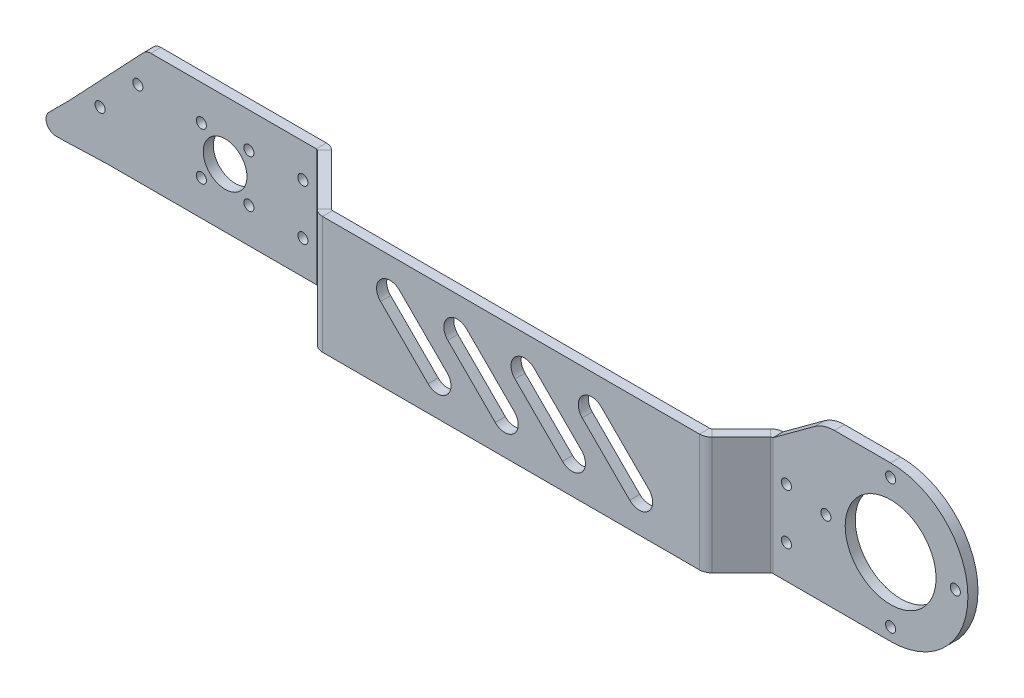
from build123d import *

# Parameters (mm, degrees)
SKETCH_1_R               = 6.5
SKETCH_1_R_2             = 1.5
SM_BASE_FLANGE_1_DEPTH   = 3
OTHER_START              = -17.5
OTHER_1_DEPTH            = 35
OTHER_1_2_DEPTH          = 35
SKETCH_7_W               = 142
SKETCH_7_H               = 35
EXTRUDE_1_DEPTH          = 3
OTHER_2_DEPTH            = 35
OTHER_START_2            = 8.571067912
OTHER_2_2_DEPTH          = 8.928932088
OTHER_2_3_DEPTH          = 26.071067912
OTHER_START_3            = 7
OTHER_2_4_OUTLINE_R      = 6.5
OTHER_2_4_OUTLINE_R_2    = 1.5
OTHER_2_4_DEPTH          = 3
OTHER_START_4            = 13.5
OTHER_2_5_OUTLINE_W      = 3.949658474
OTHER_2_5_OUTLINE_H      = 35
OTHER_2_5_DEPTH          = 3
SKETCH_9_W               = 40.525450659
SKETCH_9_H               = 35
CUT_EXTRUDE_1_DEPTH      = 216.548037247
EXTRUDE_START            = -6.5
SKETCH_10_R              = 13.515
SKETCH_10_R_2            = 1.5
EXTRUDE_2_DEPTH          = 3
FILLET_2_R               = 10
EXTRUDE_START_2          = -3
EXTRUDE_3_DEPTH          = 3
CUT_EXTRUDE_2_DEPTH      = 3
FILLET_3_R               = 3
SKETCH_13_R              = 1.5
CUT_EXTRUDE_3_DEPTH      = 3
CUT_EXTRUDE_4_DEPTH      = 10
CUT_EXTRUDE_4_DEPTH_BACK = 10
SKETCH_14_R              = 1.5
CUT_EXTRUDE_5_DEPTH      = 234.75556456


with BuildPart() as part:
    # 基体-法兰1: sheet metal written as solids
    # Sketch 1 → 基体-法兰1 (new body)
    with BuildSketch(Plane.XY):
        with BuildLine():
            Line((-55, -2.5), (-55, 17.5))
            Line((-55, 17.5), (-25, 17.5))
            Line((-25, 17.5), (25, 17.5))
            Line((25, 17.5), (68, 17.5))
            Line((68, 17.5), (68, -17.5))
            Line((68, -17.5), (25, -17.5))
            Line((25, -17.5), (-25, -17.5))
            Line((-25, -17.5), (-35, -17.5))
            ThreePointArc((-35, -17.5), (-44.006294251, -8.675059002), (-55, -2.5))
        make_face()
        Circle(SKETCH_1_R, mode=Mode.SUBTRACT)
        with Locations((7.071067812, 7.071067812)):
            Circle(SKETCH_1_R_2, mode=Mode.SUBTRACT)
        with Locations((7.071067812, -7.071067812)):
            Circle(SKETCH_1_R_2, mode=Mode.SUBTRACT)
        with Locations((-7.071067812, -7.071067812)):
            Circle(SKETCH_1_R_2, mode=Mode.SUBTRACT)
        with Locations((-7.071067812, 7.071067812)):
            Circle(SKETCH_1_R_2, mode=Mode.SUBTRACT)
    extrude(amount=-SM_BASE_FLANGE_1_DEPTH)

    # Other 1: read off the stored shape, not the designer's step
    # Other 1 outline → Other 1 (cut)
    with BuildSketch(Plane(origin=(0, 0, 0), x_dir=(1, 0, 0), z_dir=(0, 1, 0)).offset(OTHER_START)):
        with BuildLine():
            Line((29.763864432, 1.905575199), (31.669439631, 0))
            Line((31.669439631, 0), (68, 0))
            Line((68, 0), (68, 3))
            Line((68, 3), (27.121689234, 3))
            ThreePointArc((27.121689234, 3), (28.551624147, 2.715568261), (29.763864432, 1.905575199))
        make_face()
    extrude(amount=OTHER_1_DEPTH, mode=Mode.SUBTRACT)

    # Other 1 2 outline → Other 1 2 (add)
    with BuildSketch(Plane(origin=(0, 0, 0), x_dir=(1, 0, 0), z_dir=(0, 1, 0)).offset(OTHER_START)):
        with BuildLine():
            ThreePointArc((45.474549341, -13.5), (45.192664725, -13.443929664), (44.953694486, -13.284254855))
            Line((44.953694486, -13.284254855), (31.669439631, 0))
            Line((31.669439631, 0), (27.121689234, 0))
            ThreePointArc((27.121689234, 0), (27.40357385, -0.056070336), (27.642544089, -0.215745145))
            Line((27.642544089, -0.215745145), (42.832374142, -15.405575199))
            ThreePointArc((42.832374142, -15.405575199), (44.044614428, -16.215568261), (45.474549341, -16.5))
            Line((45.474549341, -16.5), (68, -16.5))
            Line((68, -16.5), (68, -13.5))
            Line((68, -13.5), (45.474549341, -13.5))
        make_face()
    extrude(amount=OTHER_1_2_DEPTH)

    # 草图7 → 凸台-拉伸1 (add)
    with BuildSketch(Plane.XY.offset(16.5)):
        with Locations((139, 0)):
            Rectangle(SKETCH_7_W, SKETCH_7_H)
    extrude(amount=-EXTRUDE_1_DEPTH)

    # Other 2: read off the stored shape, not the designer's step
    # Other 2 outline → Other 2 (cut)
    with BuildSketch(Plane(origin=(0, 0, 0), x_dir=(1, 0, 0), z_dir=(0, 1, 0)).offset(OTHER_START)):
        with BuildLine():
            Line((45.474549341, -16.5), (168.876457417, -16.5))
            Line((168.876457417, -16.5), (170.782032616, -14.594424801))
            ThreePointArc((170.782032616, -14.594424801), (171.994272902, -13.784431739), (173.424207815, -13.5))
            Line((173.424207815, -13.5), (45.474549341, -13.5))
            ThreePointArc((45.474549341, -13.5), (45.192664725, -13.443929664), (44.953694486, -13.284254855))
            Line((44.953694486, -13.284254855), (29.763864432, 1.905575199))
            ThreePointArc((29.763864432, 1.905575199), (28.551624147, 2.715568261), (27.121689234, 3))
            Line((27.121689234, 3), (-55, 3))
            Line((-55, 3), (-55, 0))
            Line((-55, 0), (27.121689234, 0))
            ThreePointArc((27.121689234, 0), (27.40357385, -0.056070336), (27.642544089, -0.215745145))
            Line((27.642544089, -0.215745145), (42.832374142, -15.405575199))
            ThreePointArc((42.832374142, -15.405575199), (44.044614428, -16.215568261), (45.474549341, -16.5))
        make_face()
    extrude(amount=OTHER_2_DEPTH, mode=Mode.SUBTRACT)

    # Other 2 2 outline → Other 2 2 (add)
    with BuildSketch(Plane(origin=(0, 0, 0), x_dir=(1, 0, 0), z_dir=(0, 1, 0)).offset(OTHER_START_2)):
        with BuildLine():
            Line((49.424207815, -26.5), (161.571347708, -26.5))
            ThreePointArc((161.571347708, -26.5), (163.001282621, -26.215568261), (164.213522906, -25.405575199))
            Line((164.213522906, -25.405575199), (172.90335296, -16.715745145))
            ThreePointArc((172.90335296, -16.715745145), (173.142323199, -16.556070336), (173.424207815, -16.5))
            Line((173.424207815, -16.5), (168.876457417, -16.5))
            Line((168.876457417, -16.5), (162.092202563, -23.284254855))
            ThreePointArc((162.092202563, -23.284254855), (161.853232324, -23.443929664), (161.571347708, -23.5))
            Line((161.571347708, -23.5), (49.424207815, -23.5))
            ThreePointArc((49.424207815, -23.5), (49.142323199, -23.443929664), (48.90335296, -23.284254855))
            Line((48.90335296, -23.284254855), (33.713522906, -8.094424801))
            ThreePointArc((33.713522906, -8.094424801), (32.501282621, -7.284431739), (31.071347708, -7))
            Line((31.071347708, -7), (-51.050341526, -7))
            Line((-51.050341526, -7), (-51.050341526, -10))
            Line((-51.050341526, -10), (31.071347708, -10))
            ThreePointArc((31.071347708, -10), (31.353232324, -10.056070336), (31.592202563, -10.215745145))
            Line((31.592202563, -10.215745145), (46.782032616, -25.405575199))
            ThreePointArc((46.782032616, -25.405575199), (47.994272902, -26.215568261), (49.424207815, -26.5))
        make_face()
    extrude(amount=OTHER_2_2_DEPTH)

    # Other 2 3 outline → Other 2 3 (add)
    with BuildSketch(Plane(origin=(0, 0, 0), x_dir=(1, 0, 0), z_dir=(0, 1, 0)).offset(OTHER_START)):
        with BuildLine():
            Line((49.424207815, -26.5), (161.571347708, -26.5))
            ThreePointArc((161.571347708, -26.5), (163.001282621, -26.215568261), (164.213522906, -25.405575199))
            Line((164.213522906, -25.405575199), (172.90335296, -16.715745145))
            ThreePointArc((172.90335296, -16.715745145), (173.142323199, -16.556070336), (173.424207815, -16.5))
            Line((173.424207815, -16.5), (168.876457417, -16.5))
            Line((168.876457417, -16.5), (162.092202563, -23.284254855))
            ThreePointArc((162.092202563, -23.284254855), (161.853232324, -23.443929664), (161.571347708, -23.5))
            Line((161.571347708, -23.5), (49.424207815, -23.5))
            ThreePointArc((49.424207815, -23.5), (49.142323199, -23.443929664), (48.90335296, -23.284254855))
            Line((48.90335296, -23.284254855), (33.713522906, -8.094424801))
            ThreePointArc((33.713522906, -8.094424801), (32.501282621, -7.284431739), (31.071347708, -7))
            Line((31.071347708, -7), (-51.050341526, -7))
            Line((-51.050341526, -7), (-51.050341526, -10))
            Line((-51.050341526, -10), (31.071347708, -10))
            ThreePointArc((31.071347708, -10), (31.353232324, -10.056070336), (31.592202563, -10.215745145))
            Line((31.592202563, -10.215745145), (46.782032616, -25.405575199))
            ThreePointArc((46.782032616, -25.405575199), (47.994272902, -26.215568261), (49.424207815, -26.5))
        make_face()
    extrude(amount=OTHER_2_3_DEPTH)

    # Other 2 4 outline → Other 2 4 (cut)
    with BuildSketch(Plane.XY.offset(OTHER_START_3)):
        with BuildLine():
            Line((-51.050341526, -17.5), (-31.050341526, -17.5))
            ThreePointArc((-31.050341526, -17.5), (-40.056635778, -8.675059002), (-51.050341526, -2.5))
            Line((-51.050341526, -2.5), (-51.050341526, -17.5))
        make_face()
        with Locations((3.949658474, 0)):
            Circle(OTHER_2_4_OUTLINE_R)
        with Locations((11.020726286, 7.071067812)):
            Circle(OTHER_2_4_OUTLINE_R_2)
        with Locations((11.020726286, -7.071067812)):
            Circle(OTHER_2_4_OUTLINE_R_2)
        with Locations((-3.121409338, -7.071067812)):
            Circle(OTHER_2_4_OUTLINE_R_2)
        with Locations((-3.121409338, 7.071067812)):
            Circle(OTHER_2_4_OUTLINE_R_2)
    extrude(amount=OTHER_2_4_DEPTH, mode=Mode.SUBTRACT)

    # Other 2 5 outline → Other 2 5 (add)
    with BuildSketch(Plane.XY.offset(OTHER_START_4)):
        with Locations((211.974829237, 0)):
            Rectangle(OTHER_2_5_OUTLINE_W, OTHER_2_5_OUTLINE_H)
    extrude(amount=OTHER_2_5_DEPTH)

    # 草图9 → 切除-拉伸1 (cut, through all)
    with BuildSketch(Plane(origin=(0, 0, 7), x_dir=(-1, 0, 0), z_dir=(0, 0, -1))):
        with Locations((-193.686933145, 0)):
            Rectangle(SKETCH_9_W, SKETCH_9_H)
    extrude(amount=-CUT_EXTRUDE_1_DEPTH, mode=Mode.SUBTRACT)

    # 草图10 → 凸台-拉伸2 (add)
    with BuildSketch(Plane(origin=(0, 0, 7), x_dir=(-1, 0, 0), z_dir=(0, 0, -1)).offset(EXTRUDE_START)):
        with BuildLine():
            Line((-188.424207815, 28.5), (-208.424207815, 28.5))
            ThreePointArc((-208.424207815, 28.5), (-231.424207815, 5.5), (-208.424207815, -17.5))
            Line((-208.424207815, -17.5), (-173.424207815, -17.5))
            Line((-173.424207815, -17.5), (-173.424207815, 17.5))
            Line((-173.424207815, 17.5), (-188.424207815, 28.5))
        make_face()
        with Locations((-208.424207815, 5.5)):
            Circle(SKETCH_10_R, mode=Mode.SUBTRACT)
        with Locations((-208.424207815, 24.75)):
            Circle(SKETCH_10_R_2, mode=Mode.SUBTRACT)
        with Locations((-208.424207815, -13.75)):
            Circle(SKETCH_10_R_2, mode=Mode.SUBTRACT)
        with Locations((-189.174207815, 5.5)):
            Circle(SKETCH_10_R_2, mode=Mode.SUBTRACT)
        with Locations((-227.674207815, 5.5)):
            Circle(SKETCH_10_R_2, mode=Mode.SUBTRACT)
    extrude(amount=-EXTRUDE_2_DEPTH)

    # 圆角2
    fillet_2_edges = [part.edges().sort_by_distance(p)[0] for p in [
        (188.424207815, 28.5, 15),
    ]]
    fillet(fillet_2_edges, radius=FILLET_2_R)

    # 草图11 → 凸台-拉伸3 (add)
    with BuildSketch(Plane.XY.offset(10).offset(EXTRUDE_START_2)):
        with BuildLine():
            Line((-42.544911581, -6.929160459), (-56.113121262, -20.49737014))
            ThreePointArc((-56.113121262, -20.49737014), (-50.357438279, -18.519812605), (-44.298570923, -17.946448179))
            Line((-44.298570923, -17.946448179), (-31.050341526, -17.5))
            ThreePointArc((-31.050341526, -17.5), (-36.364856286, -11.743992425), (-42.544911581, -6.929160459))
        make_face()
    extrude(amount=EXTRUDE_3_DEPTH)

    # 草图12 → 切除-拉伸2 (cut)
    with BuildSketch(Plane(origin=(0, 0, 7), x_dir=(-1, 0, 0), z_dir=(0, 0, -1))):
        with BuildLine():
            Line((19.45990418, 17.5), (42.544911581, -6.929160459))
            ThreePointArc((42.544911581, -6.929160459), (46.68674057, -4.501643042), (51.050341526, -2.5))
            Line((51.050341526, -2.5), (51.050341526, 17.5))
            Line((51.050341526, 17.5), (19.45990418, 17.5))
        make_face()
    extrude(amount=-CUT_EXTRUDE_2_DEPTH, mode=Mode.SUBTRACT)

    # 圆角3
    fillet_3_edges = [part.edges().sort_by_distance(p)[0] for p in [
        (-56.113121262, -20.49737014, 8.5),
        (-19.45990418, 17.5, 8.5),
    ]]
    fillet(fillet_3_edges, radius=FILLET_3_R)

    # 草图13 → 切除-拉伸3 (cut)
    with BuildSketch(Plane(origin=(0, 0, 7), x_dir=(-1, 0, 0), z_dir=(0, 0, -1))):
        with Locations(Location((22.03039431, 7.5, 0), (0, 0, 90))):
            Circle(SKETCH_13_R)
        with Locations(Location((33.261797443, -3.895419416, 0), (0, 0, 90))):
            Circle(SKETCH_13_R)
    extrude(amount=-CUT_EXTRUDE_3_DEPTH, mode=Mode.SUBTRACT)

    # 草图14 → 切除-拉伸4 (cut, two sides: drawn at the far end of the back side and taken through both)
    with BuildSketch(Plane.XY.offset(10).offset(-CUT_EXTRUDE_4_DEPTH_BACK)):
        with Locations(Location((177.424207815, -7.5, 0), (0, 0, 180))):
            Circle(SKETCH_14_R)
        with Locations(Location((177.424207815, 7.5, 0), (0, 0, 180))):
            Circle(SKETCH_14_R)
        with Locations(Location((27.071347708, -7.5, 0), (0, 0, 180))):
            Circle(SKETCH_14_R)
        with Locations(Location((27.071347708, 7.5, 0), (0, 0, 180))):
            Circle(SKETCH_14_R)
    extrude(amount=CUT_EXTRUDE_4_DEPTH + CUT_EXTRUDE_4_DEPTH_BACK, mode=Mode.SUBTRACT)

    # 草图15 → 切除-拉伸5 (cut, through all)
    with BuildSketch(Plane(origin=(0, 0, 23.5), x_dir=(-1, 0, 0), z_dir=(0, 0, -1))):
        with BuildLine():
            Line((-146.470842644, -4.242640687), (-132.328707021, 9.899494937))
            ThreePointArc((-132.328707021, 9.899494937), (-126.671852771, 9.899494937), (-126.671852771, 4.242640687))
            Line((-126.671852771, 4.242640687), (-140.813988395, -9.899494937))
            ThreePointArc((-140.813988395, -9.899494937), (-146.470842644, -9.899494937), (-146.470842644, -4.242640687))
        make_face()
        with BuildLine():
            Line((-106.671852771, 4.242640687), (-120.813988395, -9.899494937))
            ThreePointArc((-120.813988395, -9.899494937), (-126.470842644, -9.899494937), (-126.470842644, -4.242640687))
            Line((-126.470842644, -4.242640687), (-112.328707021, 9.899494937))
            ThreePointArc((-112.328707021, 9.899494937), (-106.671852771, 9.899494937), (-106.671852771, 4.242640687))
        make_face()
        with BuildLine():
            Line((-86.671852771, 4.242640687), (-100.813988395, -9.899494937))
            ThreePointArc((-100.813988395, -9.899494937), (-106.470842644, -9.899494937), (-106.470842644, -4.242640687))
            Line((-106.470842644, -4.242640687), (-92.328707021, 9.899494937))
            ThreePointArc((-92.328707021, 9.899494937), (-86.671852771, 9.899494937), (-86.671852771, 4.242640687))
        make_face()
        with BuildLine():
            Line((-66.671852771, 4.242640687), (-80.813988395, -9.899494937))
            ThreePointArc((-80.813988395, -9.899494937), (-86.470842644, -9.899494937), (-86.470842644, -4.242640687))
            Line((-86.470842644, -4.242640687), (-72.328707021, 9.899494937))
            ThreePointArc((-72.328707021, 9.899494937), (-66.671852771, 9.899494937), (-66.671852771, 4.242640687))
        make_face()
    extrude(amount=-CUT_EXTRUDE_5_DEPTH, mode=Mode.SUBTRACT)


solid = part.part
